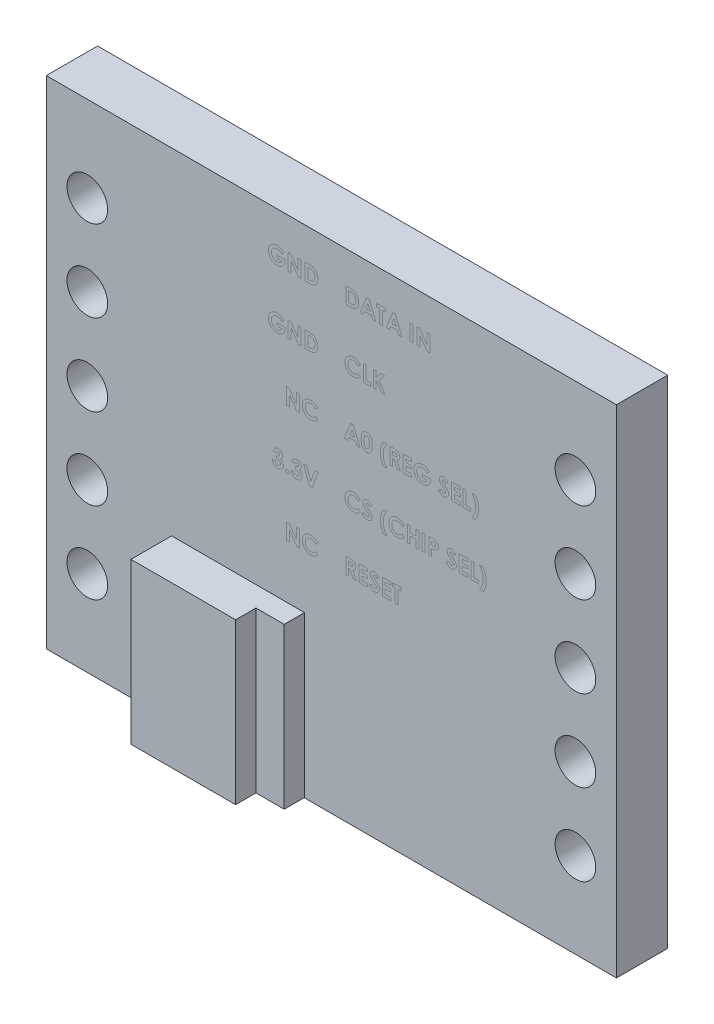
from build123d import *

# Parameters (mm, degrees)
SKETCH1_W           = 17.8
SKETCH1_H           = 15.5
SKETCH1_R           = 0.635
BOSS_EXTRUDE1_DEPTH = 1.6002
SKETCH3_W           = 4.15
SKETCH3_H           = 5
BOSS_EXTRUDE2_DEPTH = 1.27
SKETCH4_W           = 0.882017489
SKETCH4_H           = 5
CUT_EXTRUDE1_DEPTH  = 0.635


with BuildPart() as part:
    # Sketch1 → Boss-Extrude1 (new body)
    with BuildSketch(Plane.XY):
        with Locations((-64.916736456, -7.75)):
            Rectangle(SKETCH1_W, SKETCH1_H)
        with Locations((-72.536736456, -2.67)):
            Circle(SKETCH1_R, mode=Mode.SUBTRACT)
        with Locations((-72.536736456, -5.21)):
            Circle(SKETCH1_R, mode=Mode.SUBTRACT)
        with Locations((-72.536736456, -7.75)):
            Circle(SKETCH1_R, mode=Mode.SUBTRACT)
        with Locations((-72.536736456, -10.29)):
            Circle(SKETCH1_R, mode=Mode.SUBTRACT)
        with Locations((-72.536736456, -12.83)):
            Circle(SKETCH1_R, mode=Mode.SUBTRACT)
        with Locations((-57.296736456, -12.83)):
            Circle(SKETCH1_R, mode=Mode.SUBTRACT)
        with Locations((-57.296736456, -10.29)):
            Circle(SKETCH1_R, mode=Mode.SUBTRACT)
        with Locations((-57.296736456, -7.75)):
            Circle(SKETCH1_R, mode=Mode.SUBTRACT)
        with Locations((-57.296736456, -5.21)):
            Circle(SKETCH1_R, mode=Mode.SUBTRACT)
        with Locations((-57.296736456, -2.67)):
            Circle(SKETCH1_R, mode=Mode.SUBTRACT)
    extrude(amount=BOSS_EXTRUDE1_DEPTH)

    # Sketch3 → Boss-Extrude2 (add)
    with BuildSketch(Plane.XY.offset(1.6002)):
        with Locations((-67.829632963, -12.988943375)):
            Rectangle(SKETCH3_W, SKETCH3_H)
    extrude(amount=BOSS_EXTRUDE2_DEPTH)

    # Sketch4 → Cut-Extrude1 (cut)
    with BuildSketch(Plane.XY.offset(2.8702)):
        with Locations((-66.195641708, -12.988943375)):
            Rectangle(SKETCH4_W, SKETCH4_H)
    extrude(amount=-CUT_EXTRUDE1_DEPTH, mode=Mode.SUBTRACT)


solid = part.part
